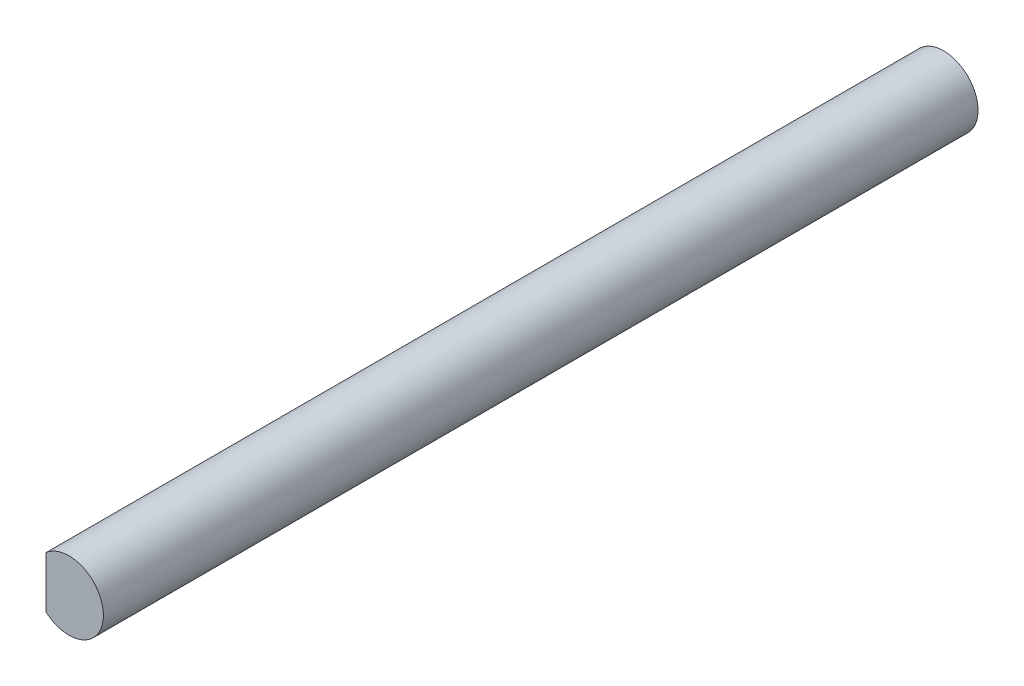
from build123d import *

# Parameters (mm, degrees)
BOSS_EXTRUDE1_DEPTH = 76.2


with BuildPart() as part:
    # Sketch1 → Boss-Extrude1 (new body)
    with BuildSketch(Plane.XY):
        with BuildLine():
            Line((-2, 2.236067977), (-2, -2.236067977))
            ThreePointArc((-2, -2.236067977), (3, 0), (-2, 2.236067977))
        make_face()
    extrude(amount=BOSS_EXTRUDE1_DEPTH)


solid = part.part
